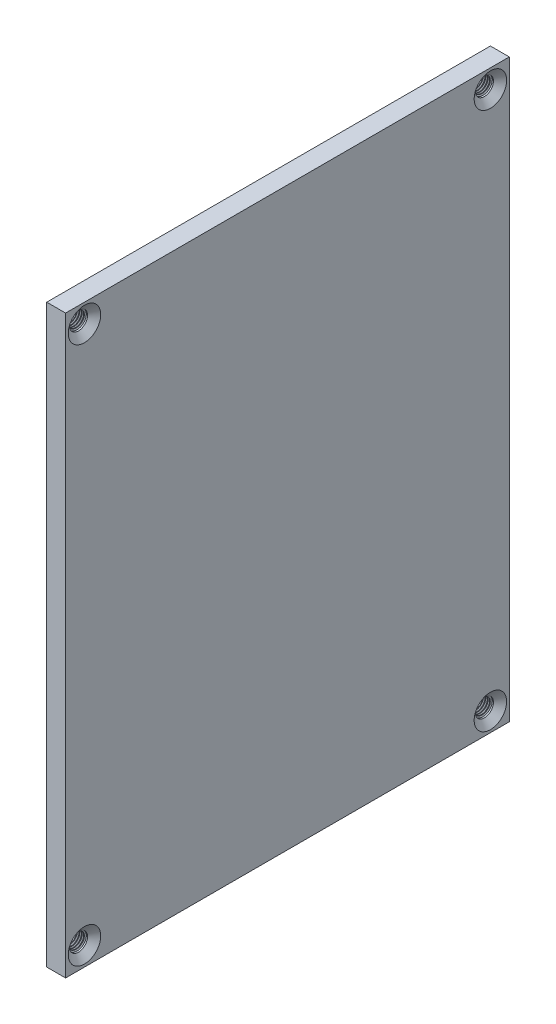
from build123d import *

# Parameters (mm, degrees)
SKETCH3_W                                         = 59.69
SKETCH3_H                                         = 77.47
BOSS_EXTRUDE2_DEPTH                               = 2.54
CSK_FOR_2_FLAT_HEAD_MACHINE_SCREW_100_D           = 2.4384
CSK_FOR_2_FLAT_HEAD_MACHINE_SCREW_100_CSINK_D     = 4.3688
CSK_FOR_2_FLAT_HEAD_MACHINE_SCREW_100_CSINK_ANGLE = 100
THREAD1_PITCH                                     = 0.3175
THREAD2_PITCH                                     = 0.3175
THREAD3_PITCH                                     = 0.3175
THREAD4_PITCH                                     = 0.3175


with BuildPart() as part:
    # Sketch3 → Boss-Extrude2 (new body)
    with BuildSketch(Plane(origin=(0, 0, 0), x_dir=(0, 0, -1), z_dir=(1, 0, 0))):
        with Locations((29.845, 38.735)):
            Rectangle(SKETCH3_W, SKETCH3_H)
    extrude(amount=BOSS_EXTRUDE2_DEPTH)

    # CSK for #2 Flat Head Machine Screw (100)1 (through all)
    with Locations(Plane(origin=(2.54, 0, 0), x_dir=(0, 0, -1), z_dir=(1, 0, 0))):
        with Locations((2.54, 74.93), (57.15, 74.93), (57.15, 2.54), (2.54, 2.54)):
            CounterSinkHole(CSK_FOR_2_FLAT_HEAD_MACHINE_SCREW_100_D / 2, CSK_FOR_2_FLAT_HEAD_MACHINE_SCREW_100_CSINK_D / 2, counter_sink_angle=CSK_FOR_2_FLAT_HEAD_MACHINE_SCREW_100_CSINK_ANGLE)

    # Thread1: the profile of Thread Profile1 profile screwed along a right-hand helix of 4.56 turns, 6 arcs to a turn; built about Z, then put on its axis
    thread1_z = Axis((0, 0, 0), (0, 0, 1))
    thread1_corners = [(1.2195, 0, -0.000173205), (1.2195, 0, 0.277985704), (1.047348085, 0, 0.17859375), (1.047348085, 0, 0.09921875)]
    with BuildLine(mode=Mode.PRIVATE) as thread1_profile:
        Line(thread1_corners[0], thread1_corners[1])
        Line(thread1_corners[1], thread1_corners[2])
        Line(thread1_corners[2], thread1_corners[3])
        Line(thread1_corners[3], thread1_corners[0])
    thread1_cap = Face(thread1_profile.wire())
    thread1_turn_angles = [0, 30, 60, 90, 120, 150, 180, 210, 240, 270, 300, 330, 360]
    thread1_turn_weights = [1, 0.8660254037844387, 1, 0.8660254037844387, 1, 0.8660254037844387, 1, 0.8660254037844387, 1, 0.8660254037844387, 1, 0.8660254037844387, 1]
    thread1_turn_rails = [Edge.make_bspline([Vector(p[0], p[1], 0).rotate(thread1_z, thread1_turn_angles[k]) / thread1_turn_weights[k] + Vector(0, 0, p[2] + THREAD1_PITCH * thread1_turn_angles[k] / 360) for k in range(13)], [0, 0, 0, 1, 1, 2, 2, 3, 3, 4, 4, 5, 5, 6, 6, 6], 2, thread1_turn_weights) for p in thread1_corners]
    thread1_turn_sides = [Face.make_surface_from_curves(thread1_turn_rails[p[0]], thread1_turn_rails[p[1]]) for p in [(0, 1), (1, 2), (2, 3), (3, 0)]]
    thread1_last_angles = [1440, 1470, 1500, 1530, 1560, 1590, 1620, 1630.8, 1641.6]
    thread1_last_weights = [1, 0.8660254037844387, 1, 0.8660254037844387, 1, 0.8660254037844387, 1, 0.9822872507286888, 1]
    thread1_last_rails = [Edge.make_bspline([Vector(p[0], p[1], 0).rotate(thread1_z, thread1_last_angles[k]) / thread1_last_weights[k] + Vector(0, 0, p[2] + THREAD1_PITCH * thread1_last_angles[k] / 360) for k in range(9)], [0, 0, 0, 1, 1, 2, 2, 3, 3, 4, 4, 4], 2, thread1_last_weights) for p in thread1_corners]
    thread1_last_sides = [Face.make_surface_from_curves(thread1_last_rails[p[0]], thread1_last_rails[p[1]]) for p in [(0, 1), (1, 2), (2, 3), (3, 0)]]
    thread1 = Plane(origin=(1.730101036, 74.93, -2.54), x_dir=(0, 0, 1), z_dir=(-1, 0, 0)) * Solid(Shell([*[p.moved(Location((0, 0, THREAD1_PITCH * i))) for i in range(4) for p in thread1_turn_sides], *thread1_last_sides, thread1_cap, thread1_cap.rotate(thread1_z, 1641.6).moved(Location((0, 0, THREAD1_PITCH * 1641.6 / 360)))]))
    add(thread1)

    # Thread2: the profile of Thread Profile2 profile screwed along a right-hand helix of 4.56 turns, 6 arcs to a turn; built about Z, then put on its axis
    thread2_z = Axis((0, 0, 0), (0, 0, 1))
    thread2_corners = [(1.2195, 0, -0.000173205), (1.2195, 0, 0.277985704), (1.047348085, 0, 0.17859375), (1.047348085, 0, 0.09921875)]
    with BuildLine(mode=Mode.PRIVATE) as thread2_profile:
        Line(thread2_corners[0], thread2_corners[1])
        Line(thread2_corners[1], thread2_corners[2])
        Line(thread2_corners[2], thread2_corners[3])
        Line(thread2_corners[3], thread2_corners[0])
    thread2_cap = Face(thread2_profile.wire())
    thread2_turn_angles = [0, 30, 60, 90, 120, 150, 180, 210, 240, 270, 300, 330, 360]
    thread2_turn_weights = [1, 0.8660254037844387, 1, 0.8660254037844387, 1, 0.8660254037844387, 1, 0.8660254037844387, 1, 0.8660254037844387, 1, 0.8660254037844387, 1]
    thread2_turn_rails = [Edge.make_bspline([Vector(p[0], p[1], 0).rotate(thread2_z, thread2_turn_angles[k]) / thread2_turn_weights[k] + Vector(0, 0, p[2] + THREAD2_PITCH * thread2_turn_angles[k] / 360) for k in range(13)], [0, 0, 0, 1, 1, 2, 2, 3, 3, 4, 4, 5, 5, 6, 6, 6], 2, thread2_turn_weights) for p in thread2_corners]
    thread2_turn_sides = [Face.make_surface_from_curves(thread2_turn_rails[p[0]], thread2_turn_rails[p[1]]) for p in [(0, 1), (1, 2), (2, 3), (3, 0)]]
    thread2_last_angles = [1440, 1470, 1500, 1530, 1560, 1590, 1620, 1630.8, 1641.6]
    thread2_last_weights = [1, 0.8660254037844387, 1, 0.8660254037844387, 1, 0.8660254037844387, 1, 0.9822872507286888, 1]
    thread2_last_rails = [Edge.make_bspline([Vector(p[0], p[1], 0).rotate(thread2_z, thread2_last_angles[k]) / thread2_last_weights[k] + Vector(0, 0, p[2] + THREAD2_PITCH * thread2_last_angles[k] / 360) for k in range(9)], [0, 0, 0, 1, 1, 2, 2, 3, 3, 4, 4, 4], 2, thread2_last_weights) for p in thread2_corners]
    thread2_last_sides = [Face.make_surface_from_curves(thread2_last_rails[p[0]], thread2_last_rails[p[1]]) for p in [(0, 1), (1, 2), (2, 3), (3, 0)]]
    thread2 = Plane(origin=(1.730101036, 74.93, -57.15), x_dir=(0, 0, 1), z_dir=(-1, 0, 0)) * Solid(Shell([*[p.moved(Location((0, 0, THREAD2_PITCH * i))) for i in range(4) for p in thread2_turn_sides], *thread2_last_sides, thread2_cap, thread2_cap.rotate(thread2_z, 1641.6).moved(Location((0, 0, THREAD2_PITCH * 1641.6 / 360)))]))
    add(thread2)

    # Thread3: the profile of Thread Profile3 profile screwed along a right-hand helix of 4.56 turns, 6 arcs to a turn; built about Z, then put on its axis
    thread3_z = Axis((0, 0, 0), (0, 0, 1))
    thread3_corners = [(1.2195, 0, -0.000173205), (1.2195, 0, 0.277985704), (1.047348085, 0, 0.17859375), (1.047348085, 0, 0.09921875)]
    with BuildLine(mode=Mode.PRIVATE) as thread3_profile:
        Line(thread3_corners[0], thread3_corners[1])
        Line(thread3_corners[1], thread3_corners[2])
        Line(thread3_corners[2], thread3_corners[3])
        Line(thread3_corners[3], thread3_corners[0])
    thread3_cap = Face(thread3_profile.wire())
    thread3_turn_angles = [0, 30, 60, 90, 120, 150, 180, 210, 240, 270, 300, 330, 360]
    thread3_turn_weights = [1, 0.8660254037844387, 1, 0.8660254037844387, 1, 0.8660254037844387, 1, 0.8660254037844387, 1, 0.8660254037844387, 1, 0.8660254037844387, 1]
    thread3_turn_rails = [Edge.make_bspline([Vector(p[0], p[1], 0).rotate(thread3_z, thread3_turn_angles[k]) / thread3_turn_weights[k] + Vector(0, 0, p[2] + THREAD3_PITCH * thread3_turn_angles[k] / 360) for k in range(13)], [0, 0, 0, 1, 1, 2, 2, 3, 3, 4, 4, 5, 5, 6, 6, 6], 2, thread3_turn_weights) for p in thread3_corners]
    thread3_turn_sides = [Face.make_surface_from_curves(thread3_turn_rails[p[0]], thread3_turn_rails[p[1]]) for p in [(0, 1), (1, 2), (2, 3), (3, 0)]]
    thread3_last_angles = [1440, 1470, 1500, 1530, 1560, 1590, 1620, 1630.8, 1641.6]
    thread3_last_weights = [1, 0.8660254037844387, 1, 0.8660254037844387, 1, 0.8660254037844387, 1, 0.9822872507286888, 1]
    thread3_last_rails = [Edge.make_bspline([Vector(p[0], p[1], 0).rotate(thread3_z, thread3_last_angles[k]) / thread3_last_weights[k] + Vector(0, 0, p[2] + THREAD3_PITCH * thread3_last_angles[k] / 360) for k in range(9)], [0, 0, 0, 1, 1, 2, 2, 3, 3, 4, 4, 4], 2, thread3_last_weights) for p in thread3_corners]
    thread3_last_sides = [Face.make_surface_from_curves(thread3_last_rails[p[0]], thread3_last_rails[p[1]]) for p in [(0, 1), (1, 2), (2, 3), (3, 0)]]
    thread3 = Plane(origin=(1.730101036, 2.54, -57.15), x_dir=(0, 0, 1), z_dir=(-1, 0, 0)) * Solid(Shell([*[p.moved(Location((0, 0, THREAD3_PITCH * i))) for i in range(4) for p in thread3_turn_sides], *thread3_last_sides, thread3_cap, thread3_cap.rotate(thread3_z, 1641.6).moved(Location((0, 0, THREAD3_PITCH * 1641.6 / 360)))]))
    add(thread3)

    # Thread4: the profile of Thread Profile4 profile screwed along a right-hand helix of 4.56 turns, 6 arcs to a turn; built about Z, then put on its axis
    thread4_z = Axis((0, 0, 0), (0, 0, 1))
    thread4_corners = [(1.2195, 0, -0.000173205), (1.2195, 0, 0.277985704), (1.047348085, 0, 0.17859375), (1.047348085, 0, 0.09921875)]
    with BuildLine(mode=Mode.PRIVATE) as thread4_profile:
        Line(thread4_corners[0], thread4_corners[1])
        Line(thread4_corners[1], thread4_corners[2])
        Line(thread4_corners[2], thread4_corners[3])
        Line(thread4_corners[3], thread4_corners[0])
    thread4_cap = Face(thread4_profile.wire())
    thread4_turn_angles = [0, 30, 60, 90, 120, 150, 180, 210, 240, 270, 300, 330, 360]
    thread4_turn_weights = [1, 0.8660254037844387, 1, 0.8660254037844387, 1, 0.8660254037844387, 1, 0.8660254037844387, 1, 0.8660254037844387, 1, 0.8660254037844387, 1]
    thread4_turn_rails = [Edge.make_bspline([Vector(p[0], p[1], 0).rotate(thread4_z, thread4_turn_angles[k]) / thread4_turn_weights[k] + Vector(0, 0, p[2] + THREAD4_PITCH * thread4_turn_angles[k] / 360) for k in range(13)], [0, 0, 0, 1, 1, 2, 2, 3, 3, 4, 4, 5, 5, 6, 6, 6], 2, thread4_turn_weights) for p in thread4_corners]
    thread4_turn_sides = [Face.make_surface_from_curves(thread4_turn_rails[p[0]], thread4_turn_rails[p[1]]) for p in [(0, 1), (1, 2), (2, 3), (3, 0)]]
    thread4_last_angles = [1440, 1470, 1500, 1530, 1560, 1590, 1620, 1630.8, 1641.6]
    thread4_last_weights = [1, 0.8660254037844387, 1, 0.8660254037844387, 1, 0.8660254037844387, 1, 0.9822872507286888, 1]
    thread4_last_rails = [Edge.make_bspline([Vector(p[0], p[1], 0).rotate(thread4_z, thread4_last_angles[k]) / thread4_last_weights[k] + Vector(0, 0, p[2] + THREAD4_PITCH * thread4_last_angles[k] / 360) for k in range(9)], [0, 0, 0, 1, 1, 2, 2, 3, 3, 4, 4, 4], 2, thread4_last_weights) for p in thread4_corners]
    thread4_last_sides = [Face.make_surface_from_curves(thread4_last_rails[p[0]], thread4_last_rails[p[1]]) for p in [(0, 1), (1, 2), (2, 3), (3, 0)]]
    thread4 = Plane(origin=(1.730101036, 2.54, -2.54), x_dir=(0, 0, 1), z_dir=(-1, 0, 0)) * Solid(Shell([*[p.moved(Location((0, 0, THREAD4_PITCH * i))) for i in range(4) for p in thread4_turn_sides], *thread4_last_sides, thread4_cap, thread4_cap.rotate(thread4_z, 1641.6).moved(Location((0, 0, THREAD4_PITCH * 1641.6 / 360)))]))
    add(thread4)


solid = part.part
